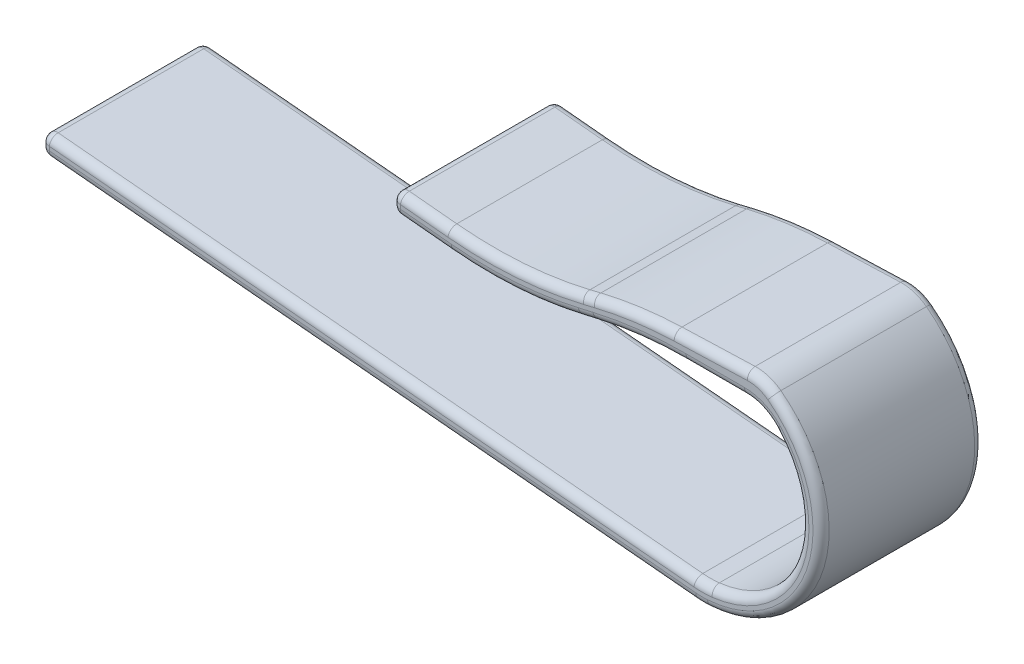
from build123d import *

# Parameters (mm, degrees)
BOSS_EXTRUDE1_DEPTH = 20
FILLET1_R           = 50
FILLET2_R           = 50
FILLET3_R           = 5
FILLET4_R           = 10
FILLET5_R           = 1
FILLET6_R           = 1


with BuildPart() as part:
    # Sketch1 → Boss-Extrude1 (new body)
    with BuildSketch(Plane.XY):
        with BuildLine():
            Line((1.53e-15, -7.5), (81.46535975563725, -15))
            ThreePointArc((81.46535975563725, -15), (95.96612319887386, -3.8376893521092743), (88.88528315077919, 13.036285391560943))
            Line((88.88528315077919, 13.036285391560943), (73.17379777974874, 12.49999999999999))
            Line((73.17379777974874, 12.49999999999999), (58.74284079566012, 9.013925925539251))
            Line((58.74284079566012, 9.013925925539251), (43.44024523082493, 10.4682923771142))
            Line((43.44024523082493, 10.4682923771142), (43.44024523082493, 7.968292377114199))
            Line((43.44024523082493, 7.968292377114199), (58.74284079566012, 6.51392592553925))
            Line((58.74284079566012, 6.51392592553925), (74.04543636049529, 10.059559473964299))
            Line((74.04543636049529, 10.059559473964299), (88.88528315077919, 10.059559473964299))
            ThreePointArc((88.88528315077919, 10.059559473964299), (93.33958590778194, -3.9054773444129744), (81.46535975563725, -12.49999999999999))
            Line((81.46535975563725, -12.49999999999999), (-7.7e-16, -5))
            Line((-7.7e-16, -5), (1.53e-15, -7.5))
        make_face()
    extrude(amount=BOSS_EXTRUDE1_DEPTH)

    # Fillet1
    fillet1_edges = [part.edges().sort_by_distance(p)[0] for p in [
        (58.74284079566012, 9.013925925539251, 10),
        (73.17379777974874, 12.49999999999999, 10),
    ]]
    fillet(fillet1_edges, radius=FILLET1_R)

    # Fillet2
    fillet2_edges = [part.edges().sort_by_distance(p)[0] for p in [
        (74.04543636049529, 10.059559473964299, 10),
        (58.74284079566012, 6.51392592553925, 10),
    ]]
    fillet(fillet2_edges, radius=FILLET2_R)

    # Fillet3
    fillet3_edges = [part.edges().sort_by_distance(p)[0] for p in [
        (88.88528315077919, 10.059559473964299, 10),
        (88.88528315077919, 13.036285391560945, 10),
    ]]
    fillet(fillet3_edges, radius=FILLET3_R)

    # Fillet4
    # the kernel refuses this fillet: 10 mm, written as the material it adds along each edge
    with BuildSketch(Plane(origin=(81.46535975563725, -12.499999999999993, 0), x_dir=(0.9983825762287738, 0.05685271746184882, 0), z_dir=(0, 0, 1))) as fillet4_piece_1:
        with BuildLine():
            CenterArc((0.8527907619277444, 9.983825762287736), FILLET4_R, 261.4807895615496, 11.77838854979251)
            Line((-0.6286192920357523, 0.09416326794467102), (0, 0))
            ThreePointArc((0, 0), (0.7106589682731511, -0.02021779714032781), (1.4213179365462814, 1e-17))
        make_face()
    extrude(amount=20)
    # the kernel refuses this fillet: 10 mm, written as the material it takes off along each edge
    with BuildSketch(Plane(origin=(81.46535975563715, -14.999999999999993, -2.523941837712784), x_dir=(-0.9957888906378437, 0.09167597985433422, 0), z_dir=(0, 0, 1))) as fillet4_2_piece_1:
        with BuildLine():
            CenterArc((0.5828793997689569, -10), FILLET4_R, 90.00000000000003, 9.11705963897387)
            ThreePointArc((-1.0016411963229432, -0.12633328086467327), (-0.5018837587629004, -0.05473730613968529), (0, 0))
            Line((0, 0), (0.5828793997689534, 0))
        make_face()
    extrude(amount=25.047883675425567, mode=Mode.SUBTRACT)

    # Fillet5
    fillet5_edges = [part.edges().sort_by_distance(p)[0] for p in [
        (1.53e-15, -7.5, 10),
        (-7.7e-16, -5, 10),
        (43.44024523082493, 7.968292377114199, 10),
        (43.44024523082493, 10.4682923771142, 10),
    ]]
    fillet(fillet5_edges, radius=FILLET5_R)

    # Fillet6
    fillet6_edges = [part.edges().sort_by_distance(p)[0] for p in [
        (67.55312596624809, 11.142219063385667, 0),
        (67.55312596624809, 11.142219063385667, 20),
        (82.78750373367262, 12.828147844719894, 0),
        (73.2087271321753, 12.243940169804823, 0),
        (82.78750373367262, 12.828147844719894, 20),
        (73.2087271321753, 12.243940169804823, 20),
        (58.69337304228126, 9.708148200467306, 0),
        (58.69337304228126, 9.708148200467306, 20),
        (83.38196474552188, 10.059559473964299, 0),
        (83.38196474552188, 10.059559473964299, 20),
        (67.57035497563798, 8.559273742065987, 0),
        (67.57035497563798, 8.559273742065987, 20),
        (58.69921223462093, 7.16938370928515, 0),
        (58.69921223462093, 7.16938370928515, 20),
        (74.08244123035955, 9.73590992988975, 0),
        (74.08244123035955, 9.73590992988975, 20),
        (88.99028016615965, 12.753456202652604, 0),
        (88.99028016615965, 12.753456202652604, 20),
        (89.0184612808635, 9.634775220054735, 0),
        (89.0184612808635, 9.634775220054735, 20),
        (95.84204739674057, -4.27911818838268, 0),
        (95.84204739674057, -4.27911818838268, 20),
        (93.17154749853181, -4.383510981862012, 0),
        (81.6792624975188, -14.987925542926858, 0),
        (93.17154749853181, -4.383510981862012, 20),
        (81.6792624975188, -14.987925542926858, 20),
        (81.85897083662152, -12.483235942602048, 0),
        (81.85897083662152, -12.483235942602048, 20),
        (47.4966925492185, 7.582765564524983, 0),
        (47.4966925492185, 7.582765564524983, 20),
        (40.89662947245553, -11.265093801383376, 0),
        (4.7e-16, -6.342063670037142, 0),
        (40.96203987478691, -8.771115723080602, 0),
        (43.44024523082493, 9.123251869416467, 0),
        (47.471858609430626, 10.085125794770558, 0),
        (0.326084567565907, -5.3574840944297595, 0),
        (0.261191506595139, -7.2617501846737555, 0),
        (43.767420646607164, 10.108547727110885, 0),
        (43.70044317698066, 8.204933481348554, 0),
        (43.44024523082493, 9.123251869416467, 20),
        (40.89662947245553, -11.265093801383376, 20),
        (47.471858609430626, 10.085125794770558, 20),
        (40.96203987478691, -8.771115723080602, 20),
        (4.7e-16, -6.342063670037142, 20),
        (0.326084567565907, -5.3574840944297595, 20),
        (0.261191506595139, -7.2617501846737555, 20),
        (43.767420646607164, 10.108547727110885, 20),
        (43.70044317698066, 8.204933481348554, 20),
    ]]
    fillet(fillet6_edges, radius=FILLET6_R)


solid = part.part
